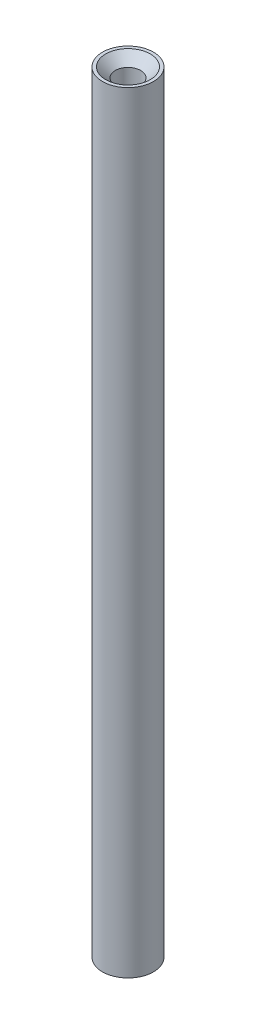
from build123d import *

# Parameters (mm, degrees)
SKETCH1_R           = 2
SKETCH1_R_2         = 1
BOSS_EXTRUDE1_DEPTH = 60.5
CHAMFER1_SIZE       = 0.75


with BuildPart() as part:
    # Sketch1 → Boss-Extrude1 (new body)
    with BuildSketch(Plane(origin=(0, 0, 0), x_dir=(1, 0, 0), z_dir=(0, 1, 0))):
        Circle(SKETCH1_R)
        Circle(SKETCH1_R_2, mode=Mode.SUBTRACT)
    extrude(amount=BOSS_EXTRUDE1_DEPTH)

    # Chamfer1
    chamfer1_edges = [part.edges().sort_by_distance(p)[0] for p in [
        (-1, 60.5, 0),
    ]]
    chamfer(chamfer1_edges, length=CHAMFER1_SIZE)


solid = part.part
